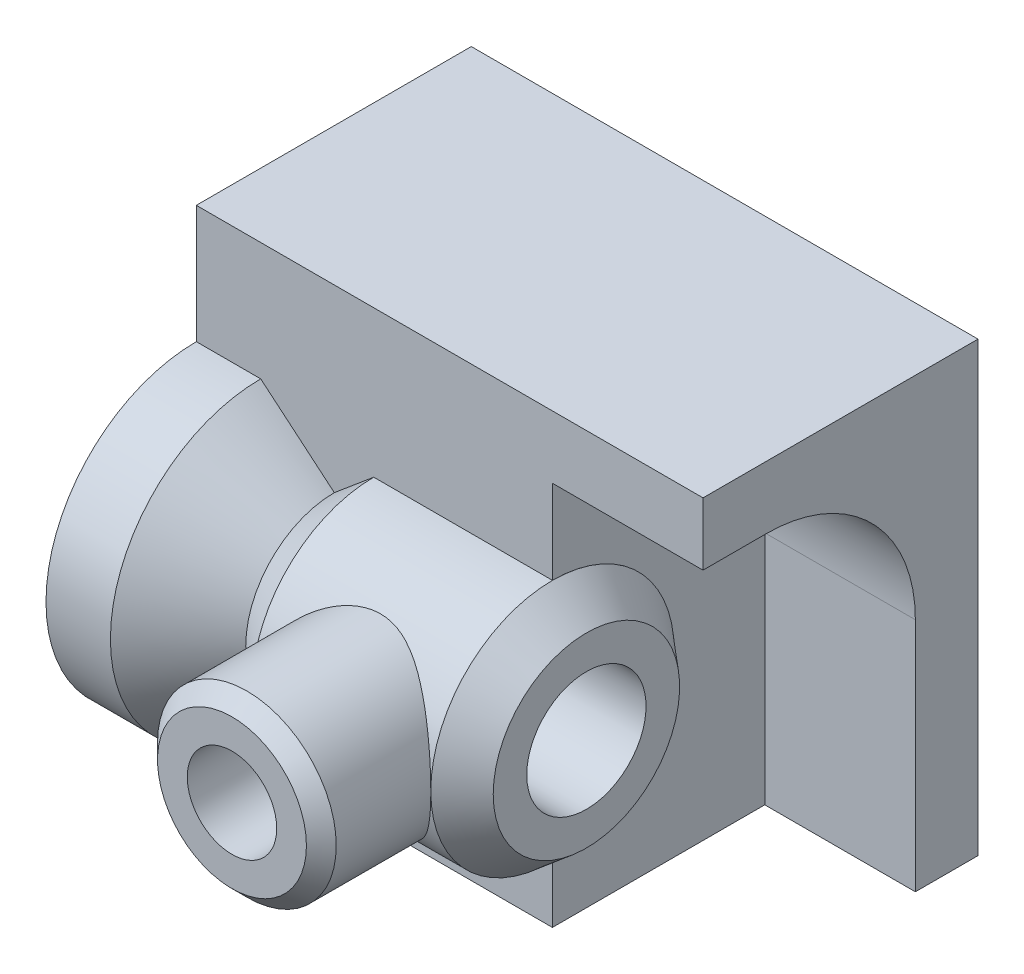
from build123d import *

# Parameters (mm, degrees)
SKETCH2_R           = 2.996049
BOSS_EXTRUDE1_DEPTH = 7.75
SKETCH3_W           = 9.22
SKETCH3_H           = 15
BOSS_EXTRUDE2_DEPTH = 11.94
BOSS_EXTRUDE3_DEPTH = 5.05
FILLET1_START       = 11.94
FILLET1_DEPTH       = 5.05
SKETCH5_R           = 1.5
CUT_EXTRUDE1_DEPTH  = 7.75
SKETCH6_R           = 2
CUT_EXTRUDE2_DEPTH  = 13.08
CUT_EXTRUDE3_START  = -3
SKETCH7_R           = 3.65
CUT_EXTRUDE3_DEPTH  = 3


with BuildPart() as part:
    # Sketch1 → Revolve1 (revolve)
    with BuildSketch(Plane.XY, mode=Mode.PRIVATE) as revolve1_sk:
        Polygon((0, 3.65), (3, 3.65), (3, 2), (13.08, 2), (13.08, 3.125), (11.941875, 4.08), (5.949776, 4.08), (4.62693, 2.97), (2.16, 5.04), (0, 5.04), align=None)
    revolve(revolve1_sk.sketch.rotate(Axis((-0.163685, 0, 0), (1, 0, 0)), 90), axis=Axis((-0.163685, 0, 0), (1, 0, 0)))

    # Sketch2 → Boss-Extrude1 (add)
    with BuildSketch(Plane.XY):
        with Locations((8.945826, 0)):
            Circle(SKETCH2_R)
    extrude(amount=BOSS_EXTRUDE1_DEPTH)

    # Sketch3 → Boss-Extrude2 (add)
    with BuildSketch(Plane.ZY):
        with Locations((-4.61, 1.5)):
            Rectangle(SKETCH3_W, SKETCH3_H)
    extrude(amount=-BOSS_EXTRUDE2_DEPTH)

    # Sketch4 → Boss-Extrude3 (add)
    with BuildSketch(Plane(origin=(11.94, 0, 0), x_dir=(0, 0, -1), z_dir=(1, 0, 0))):
        Polygon((0, 9), (9.22, 9), (9.22, -6), (7.12, -6), (7.12, 6.9), (0, 6.9), align=None)
    extrude(amount=BOSS_EXTRUDE3_DEPTH)

    # Fillet1: read off the stored shape, not the designer's step
    # Fillet1 outline → Fillet1 (add)
    with BuildSketch(Plane.YZ.offset(FILLET1_START)):
        with BuildLine():
            ThreePointArc((6.9, -2.12), (5.435534, -5.655534), (1.9, -7.12))
            Line((1.9, -7.12), (6.9, -7.12))
            Line((6.9, -7.12), (6.9, -2.12))
        make_face()
    extrude(amount=FILLET1_DEPTH)

    # Chamfer1: read off the stored shape, not the designer's step
    # Chamfer1 outline → Chamfer1 (revolve, cut)
    with BuildSketch(Plane(origin=(8.945826, 0, 0), x_dir=(1, 0, 0), z_dir=(0, -1, 0))):
        Polygon((2.996049, 7.75), (2.496049, 7.75), (2.996049, 7.25), align=None)
    revolve(axis=Axis((8.945826, 0, 0), (0, 0, 1)), mode=Mode.SUBTRACT)

    # Sketch5 → Cut-Extrude1 (cut)
    with BuildSketch(Plane.XY.offset(7.75)):
        with Locations((8.945826, 0)):
            Circle(SKETCH5_R)
    extrude(amount=-CUT_EXTRUDE1_DEPTH, mode=Mode.SUBTRACT)

    # Sketch6 → Cut-Extrude2 (cut)
    with BuildSketch(Plane(origin=(13.08, 0, 0), x_dir=(0, 0, -1), z_dir=(1, 0, 0))):
        with Locations(Location((0, 0, 0), (0, 0, 180))):
            Circle(SKETCH6_R)
    extrude(amount=-CUT_EXTRUDE2_DEPTH, mode=Mode.SUBTRACT)

    # Sketch7 → Cut-Extrude3 (cut)
    with BuildSketch(Plane.ZY.offset(CUT_EXTRUDE3_START)):
        Circle(SKETCH7_R)
    extrude(amount=CUT_EXTRUDE3_DEPTH, mode=Mode.SUBTRACT)


solid = part.part
